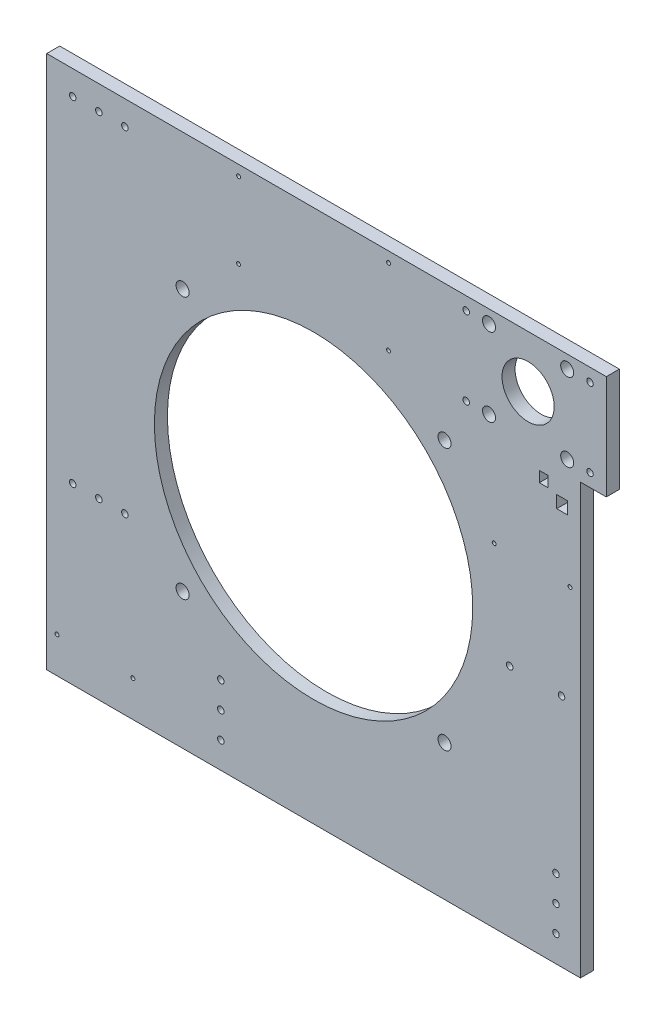
from build123d import *

# Parameters (mm, degrees)
SKETCH1_W           = 260.096
SKETCH1_H           = 260.096
BOSS_EXTRUDE1_DEPTH = 6.35
SKETCH2_R           = 77.5645
CUT_EXTRUDE1_DEPTH  = 368.886097769
SKETCH3_W           = 12.604
SKETCH3_H           = 50.8
BOSS_EXTRUDE2_DEPTH = 6.35
SKETCH5_R           = 3.175
CUT_EXTRUDE2_DEPTH  = 377.902562629
SKETCH6_R           = 1.5875
CUT_EXTRUDE3_DEPTH  = 377.902562629
SKETCH7_R           = 1.5875
CUT_EXTRUDE4_DEPTH  = 377.902562629
SKETCH8_R           = 0.9525
CUT_EXTRUDE5_DEPTH  = 377.902562629
SKETCH9_R           = 12.7
CUT_EXTRUDE6_DEPTH  = 377.902562629
SKETCH10_R          = 3.175
CUT_EXTRUDE7_DEPTH  = 377.902562629
CAVITY1_START       = 248.539
CAVITY1_OUTLINE_W   = 5.969
CAVITY1_OUTLINE_H   = 6.35
CAVITY1_DEPTH       = 5.207
CAVITY1_START_2     = 240.072333333
CAVITY1_2_OUTLINE_W = 5.207
CAVITY1_2_OUTLINE_H = 6.35
CAVITY1_2_DEPTH     = 4.233333334
SKETCH11_R          = 1.5875
CUT_EXTRUDE8_DEPTH  = 377.902562629


# Read off the part's stored shape, not the designer's step: Cavity1
with BuildPart() as part:
    # Sketch1 → Boss-Extrude1 (new body)
    with BuildSketch(Plane.XY):
        with Locations((130.048, 130.048)):
            Rectangle(SKETCH1_W, SKETCH1_H)
    extrude(amount=BOSS_EXTRUDE1_DEPTH)

    # Sketch2 → Cut-Extrude1 (cut, through all)
    with BuildSketch(Plane.XY.offset(6.35)):
        with Locations((130.048, 130.048)):
            Circle(SKETCH2_R)
    extrude(amount=-CUT_EXTRUDE1_DEPTH, mode=Mode.SUBTRACT)

    # Sketch3 → Boss-Extrude2 (add)
    with BuildSketch(Plane(origin=(0, 0, 0), x_dir=(-1, 0, 0), z_dir=(0, 0, -1))):
        with Locations((-266.398, 234.696)):
            Rectangle(SKETCH3_W, SKETCH3_H)
    extrude(amount=-BOSS_EXTRUDE2_DEPTH)

    # Sketch5 → Cut-Extrude2 (cut, through all)
    with BuildSketch(Plane.XY.offset(6.35)):
        with Locations((193.87464005, 66.22135995)):
            Circle(SKETCH5_R)
        with Locations(Location((66.22135995, 193.87464005, 0), (0, 0, 180))):
            Circle(SKETCH5_R)
        with Locations(Location((193.87464005, 193.87464005, 0), (0, 0, 180))):
            Circle(SKETCH5_R)
        with Locations((66.22135995, 66.22135995)):
            Circle(SKETCH5_R)
    extrude(amount=-CUT_EXTRUDE2_DEPTH, mode=Mode.SUBTRACT)

    # Sketch6 → Cut-Extrude3 (cut, through all)
    with BuildSketch(Plane.XY.offset(6.35)):
        with Locations((264.7625, 253.746)):
            Circle(SKETCH6_R)
        with Locations((264.7625, 215.646)):
            Circle(SKETCH6_R)
        with Locations((204.4375, 253.746)):
            Circle(SKETCH6_R)
        with Locations((204.4375, 215.646)):
            Circle(SKETCH6_R)
    extrude(amount=-CUT_EXTRUDE3_DEPTH, mode=Mode.SUBTRACT)

    # Sketch7 → Cut-Extrude4 (cut, through all)
    with BuildSketch(Plane.XY.offset(6.35)):
        with Locations((248.189, 12.796)):
            Circle(SKETCH7_R)
        with Locations((248.189, 25.496)):
            Circle(SKETCH7_R)
        with Locations((248.189, 38.196)):
            Circle(SKETCH7_R)
        with Locations((84.867, 12.796)):
            Circle(SKETCH7_R)
        with Locations((84.867, 25.496)):
            Circle(SKETCH7_R)
        with Locations((84.867, 38.196)):
            Circle(SKETCH7_R)
        with Locations((12.7, 84.963)):
            Circle(SKETCH7_R)
        with Locations((25.4, 84.963)):
            Circle(SKETCH7_R)
        with Locations((38.1, 84.963)):
            Circle(SKETCH7_R)
        with Locations((38.1, 248.285)):
            Circle(SKETCH7_R)
        with Locations((25.4, 248.285)):
            Circle(SKETCH7_R)
        with Locations((12.7, 248.285)):
            Circle(SKETCH7_R)
    extrude(amount=-CUT_EXTRUDE4_DEPTH, mode=Mode.SUBTRACT)

    # Sketch8 → Cut-Extrude5 (cut, through all)
    with BuildSketch(Plane(origin=(0, 0, 0), x_dir=(-1, 0, 0), z_dir=(0, 0, -1))):
        with Locations((-255.0541, 162.4584)):
            Circle(SKETCH8_R)
        with Locations((-218.0717, 162.4584)):
            Circle(SKETCH8_R)
        with Locations((-166.5986, 218.0717)):
            Circle(SKETCH8_R)
        with Locations((-166.5986, 255.0541)):
            Circle(SKETCH8_R)
        with Locations((-93.4974, 218.0717)):
            Circle(SKETCH8_R)
        with Locations((-93.4974, 255.0541)):
            Circle(SKETCH8_R)
        with Locations((-5.0419, 17.5006)):
            Circle(SKETCH8_R)
        with Locations((-42.0243, 17.5006)):
            Circle(SKETCH8_R)
    extrude(amount=-CUT_EXTRUDE5_DEPTH, mode=Mode.SUBTRACT)

    # Sketch9 → Cut-Extrude6 (cut, through all)
    with BuildSketch(Plane(origin=(0, 0, 0), x_dir=(-1, 0, 0), z_dir=(0, 0, -1))):
        with Locations((-234.6, 234.696)):
            Circle(SKETCH9_R)
    extrude(amount=-CUT_EXTRUDE6_DEPTH, mode=Mode.SUBTRACT)

    # Sketch10 → Cut-Extrude7 (cut, through all)
    with BuildSketch(Plane(origin=(0, 0, 0), x_dir=(-1, 0, 0), z_dir=(0, 0, -1))):
        with Locations((-215.55, 253.746)):
            Circle(SKETCH10_R)
        with Locations((-215.55, 215.646)):
            Circle(SKETCH10_R)
        with Locations((-253.65, 253.746)):
            Circle(SKETCH10_R)
        with Locations((-253.65, 215.646)):
            Circle(SKETCH10_R)
    extrude(amount=-CUT_EXTRUDE7_DEPTH, mode=Mode.SUBTRACT)

    # Cavity1 outline → Cavity1 (cut)
    with BuildSketch(Plane.YZ.offset(CAVITY1_START)):
        with Locations((195.2625, 3.175)):
            Rectangle(CAVITY1_OUTLINE_W, CAVITY1_OUTLINE_H)
    extrude(amount=CAVITY1_DEPTH, mode=Mode.SUBTRACT)

    # Cavity1 2 outline → Cavity1 2 (cut)
    with BuildSketch(Plane.YZ.offset(CAVITY1_START_2)):
        with Locations((201.6125, 3.175)):
            Rectangle(CAVITY1_2_OUTLINE_W, CAVITY1_2_OUTLINE_H)
    extrude(amount=CAVITY1_2_DEPTH, mode=Mode.SUBTRACT)

    # Sketch11 → Cut-Extrude8 (cut, through all)
    with BuildSketch(Plane(origin=(0, 0, 0), x_dir=(-1, 0, 0), z_dir=(0, 0, -1))):
        with Locations((-225.6155, 114.4369)):
            Circle(SKETCH11_R)
        with Locations((-250.8885, 114.4369)):
            Circle(SKETCH11_R)
    extrude(amount=-CUT_EXTRUDE8_DEPTH, mode=Mode.SUBTRACT)


solid = part.part
